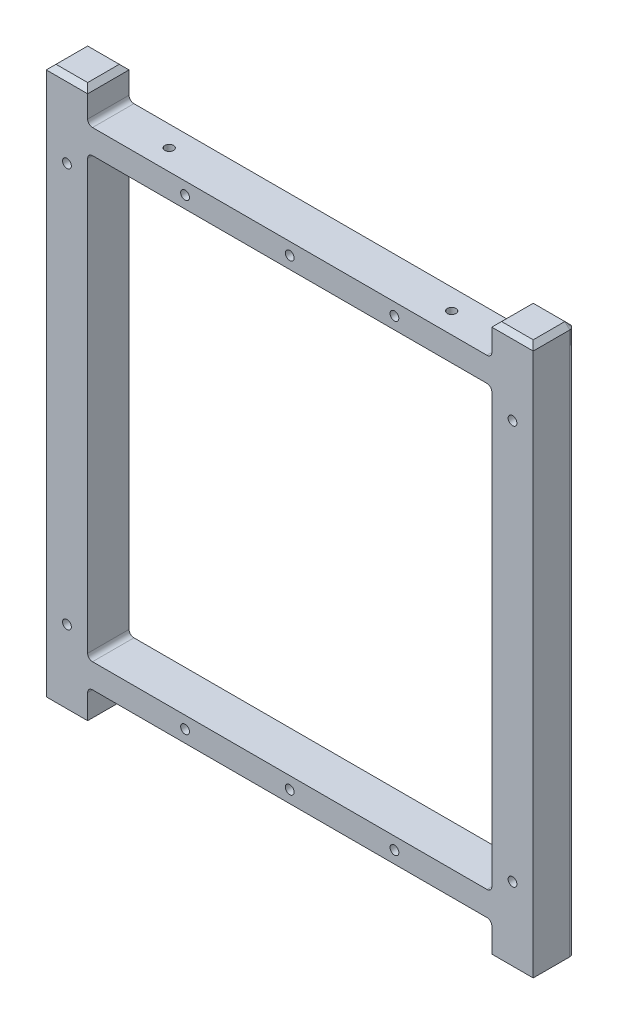
from build123d import *

# Parameters (mm, degrees)
SKETCH1_W                            = 100
SKETCH1_H                            = 113.5
BOSS_EXTRUDE1_DEPTH                  = 4.25
CUT_EXTRUDE1_DEPTH                   = 77.110528181
M1_6_HOLE1_INTUNION_D                = 1.8
M1_6_HOLE1_INTUNION_DEPTH            = 5
M1_6_HOLE1_INTUNION_TIP              = 0.540774557
M1_6_HOLE2_INTUNIONPLATE_D           = 1.8
M1_6_HOLE2_INTUNIONPLATE_CSINK_D     = 3.6
M1_6_HOLE2_INTUNIONPLATE_CSINK_ANGLE = 90
M1_6_HOLE3_EXTUNIONSIDE_D            = 1.8
M1_6_HOLE3_EXTUNIONSIDE_DEPTH        = 3
M1_6_HOLE3_EXTUNIONSIDE_TIP          = 0.540774557
M1_6_HOLE4_INTUNIONTOP_D             = 1.8
M1_6_HOLE4_INTUNIONTOP_DEPTH         = 3
M1_6_HOLE4_INTUNIONTOP_TIP           = 0.540774557
M1_6_HOLE5_EXTUNIONTOP_D             = 1.8
M1_6_HOLE5_EXTUNIONTOP_DEPTH         = 2
M1_6_HOLE5_EXTUNIONTOP_TIP           = 0.540774557
M1_6_HOLE6_EXTUNIONTOP_D             = 1.8
M1_6_HOLE6_EXTUNIONTOP_DEPTH         = 3
M1_6_HOLE6_EXTUNIONTOP_TIP           = 0.540774557
FILLET1_R                            = 1
CHAMFER1_SIZE                        = 1


with BuildPart() as part:
    # Sketch1 → Boss-Extrude1 (new, symmetric)
    with BuildSketch(Plane.XY):
        Rectangle(SKETCH1_W, SKETCH1_H)
    extrude(amount=BOSS_EXTRUDE1_DEPTH, both=True)

    # Sketch4 → Cut-Extrude1 (cut, through all)
    with BuildSketch(Plane.XY.offset(4.25)):
        with BuildLine():
            Line((-40.5, -44.75), (40.5, -44.75))
            ThreePointArc((40.5, -44.75), (41.207106781, -44.457106781), (41.5, -43.75))
            Line((41.5, -43.75), (41.5, 44.25))
            ThreePointArc((41.5, 44.25), (41.207106781, 44.957106781), (40.5, 45.25))
            Line((40.5, 45.25), (-40.5, 45.25))
            ThreePointArc((-40.5, 45.25), (-41.207106781, 44.957106781), (-41.5, 44.25))
            Line((-41.5, 44.25), (-41.5, -43.75))
            ThreePointArc((-41.5, -43.75), (-41.207106781, -44.457106781), (-40.5, -44.75))
        make_face()
        with BuildLine():
            Line((-41.5, 56.75), (41.5, 56.75))
            Line((41.5, 56.75), (41.5, 51.25))
            ThreePointArc((41.5, 51.25), (41.207106781, 50.542893219), (40.5, 50.25))
            Line((40.5, 50.25), (-40.5, 50.25))
            ThreePointArc((-40.5, 50.25), (-41.207106781, 50.542893219), (-41.5, 51.25))
            Line((-41.5, 51.25), (-41.5, 56.75))
        make_face()
        with BuildLine():
            Line((-41.5, -56.75), (41.5, -56.75))
            Line((41.5, -56.75), (41.5, -50.75))
            ThreePointArc((41.5, -50.75), (41.207106781, -50.042893219), (40.5, -49.75))
            Line((40.5, -49.75), (-40.5, -49.75))
            ThreePointArc((-40.5, -49.75), (-41.207106781, -50.042893219), (-41.5, -50.75))
            Line((-41.5, -50.75), (-41.5, -56.75))
        make_face()
    extrude(amount=-CUT_EXTRUDE1_DEPTH, mode=Mode.SUBTRACT)

    # M1.6 Hole1-IntUnion
    with Locations(Plane.XY.offset(4.25)):
        with Locations((-45.75, -40.75), (45.75, -40.75), (-45.75, 41.25), (45.75, 41.25)):
            Hole(M1_6_HOLE1_INTUNION_D / 2, depth=M1_6_HOLE1_INTUNION_DEPTH)
            with Locations((0, 0, -(M1_6_HOLE1_INTUNION_DEPTH + M1_6_HOLE1_INTUNION_TIP / 2))):  # 118° drill point
                Cone(0, M1_6_HOLE1_INTUNION_D / 2, M1_6_HOLE1_INTUNION_TIP, mode=Mode.SUBTRACT)

    # M1.6 Hole2-IntUnionPlate (through all)
    with Locations(Plane(origin=(0, 0, -4.25), x_dir=(-1, 0, 0), z_dir=(0, 0, -1))):
        with Locations((-21.5, 47.75), (21.5, 47.75), (-21.5, -47.25), (21.5, -47.25)):
            CounterSinkHole(M1_6_HOLE2_INTUNIONPLATE_D / 2, M1_6_HOLE2_INTUNIONPLATE_CSINK_D / 2, counter_sink_angle=M1_6_HOLE2_INTUNIONPLATE_CSINK_ANGLE)

    # M1.6 Hole3-ExtUnionSide
    with Locations(Plane(origin=(0, 0, -4.25), x_dir=(-1, 0, 0), z_dir=(0, 0, -1))):
        with Locations((-35.5, 47.75), (35.5, 47.75), (-35.5, -47.25), (35.5, -47.25)):
            Hole(M1_6_HOLE3_EXTUNIONSIDE_D / 2, depth=M1_6_HOLE3_EXTUNIONSIDE_DEPTH)
            with Locations((0, 0, -(M1_6_HOLE3_EXTUNIONSIDE_DEPTH + M1_6_HOLE3_EXTUNIONSIDE_TIP / 2))):  # 118° drill point
                Cone(0, M1_6_HOLE3_EXTUNIONSIDE_D / 2, M1_6_HOLE3_EXTUNIONSIDE_TIP, mode=Mode.SUBTRACT)

    # M1.6 Hole4-IntUnionTop
    with Locations(Plane.XY.offset(4.25)):
        with Locations((0, 47.75), (0, -47.25)):
            Hole(M1_6_HOLE4_INTUNIONTOP_D / 2, depth=M1_6_HOLE4_INTUNIONTOP_DEPTH)
            with Locations((0, 0, -(M1_6_HOLE4_INTUNIONTOP_DEPTH + M1_6_HOLE4_INTUNIONTOP_TIP / 2))):  # 118° drill point
                Cone(0, M1_6_HOLE4_INTUNIONTOP_D / 2, M1_6_HOLE4_INTUNIONTOP_TIP, mode=Mode.SUBTRACT)

    # M1.6 Hole5-ExtUnionTop
    with Locations(Plane(origin=(0, 50.25, 0), x_dir=(1, 0, 0), z_dir=(0, 1, 0))):
        with Locations((-29, 0), (29, 0)):
            Hole(M1_6_HOLE5_EXTUNIONTOP_D / 2, depth=M1_6_HOLE5_EXTUNIONTOP_DEPTH)
            with Locations((0, 0, -(M1_6_HOLE5_EXTUNIONTOP_DEPTH + M1_6_HOLE5_EXTUNIONTOP_TIP / 2))):  # 118° drill point
                Cone(0, M1_6_HOLE5_EXTUNIONTOP_D / 2, M1_6_HOLE5_EXTUNIONTOP_TIP, mode=Mode.SUBTRACT)

    # M1.6 Hole6-ExtUnionTop
    with Locations(Plane(origin=(0, -49.75, 0), x_dir=(-1, 0, 0), z_dir=(0, -1, 0))):
        with Locations((29, 0), (-29, 0)):
            Hole(M1_6_HOLE6_EXTUNIONTOP_D / 2, depth=M1_6_HOLE6_EXTUNIONTOP_DEPTH)
            with Locations((0, 0, -(M1_6_HOLE6_EXTUNIONTOP_DEPTH + M1_6_HOLE6_EXTUNIONTOP_TIP / 2))):  # 118° drill point
                Cone(0, M1_6_HOLE6_EXTUNIONTOP_D / 2, M1_6_HOLE6_EXTUNIONTOP_TIP, mode=Mode.SUBTRACT)

    # Fillet1
    fillet1_edges = [part.edges().sort_by_distance(p)[0] for p in [
        (-50, 0, -4.25),
        (50, 0, -4.25),
    ]]
    fillet(fillet1_edges, radius=FILLET1_R)

    # Chamfer1
    chamfer1_edges = [part.edges().sort_by_distance(p)[0] for p in [
        (-45.75, -56.75, 4.25),
        (45.25, -56.75, -4.25),
        (45.75, -56.75, 4.25),
        (-45.25, -56.75, -4.25),
        (-49.707106781, -56.75, -3.957106781),
        (45.25, 56.75, -4.25),
        (-49.707106781, 56.75, -3.957106781),
        (49.707106781, 56.75, -3.957106781),
        (49.707106781, -56.75, -3.957106781),
        (41.5, -56.75, 0),
        (-41.5, -56.75, 0),
        (-45.25, 56.75, -4.25),
        (-45.75, 56.75, 4.25),
        (-41.5, 56.75, 0),
        (41.5, 56.75, 0),
        (45.75, 56.75, 4.25),
        (50, -56.75, 0.5),
        (-50, -56.75, 0.5),
        (-50, 56.75, 0.5),
        (50, 56.75, 0.5),
    ]]
    chamfer(chamfer1_edges, length=CHAMFER1_SIZE - 0.0001)  # a hair under: the kernel refuses the full size


solid = part.part
